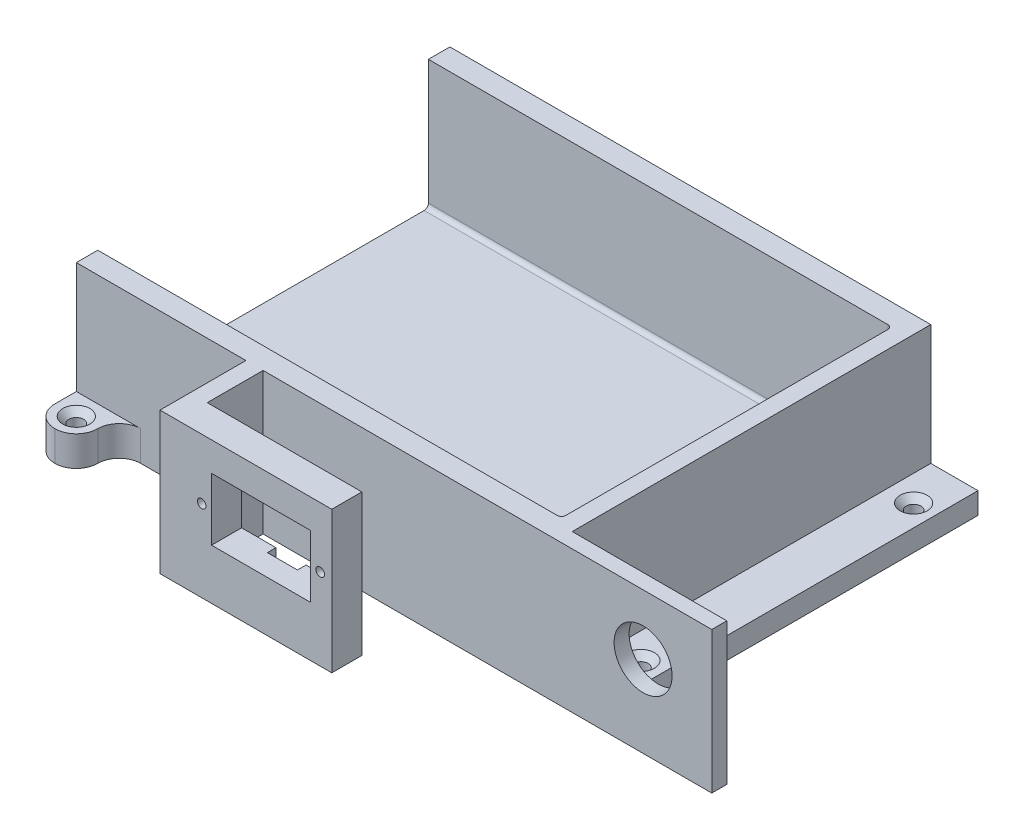
from build123d import *

# Parameters (mm, degrees)
ESQUISSE1_W                                    = 138
ESQUISSE1_H                                    = 77
BOSS_EXTRU_1_DEPTH                             = 3
ESQUISSE2_W                                    = 15
ESQUISSE2_H                                    = 77
BOSS_EXTRU_2_DEPTH                             = 30
CONG_1_R                                       = 13.85
ESQUISSE3_W                                    = 138
ESQUISSE3_H                                    = 33
BOSS_EXTRU_3_DEPTH                             = 5
ENL_V_MAT_EXTRU_13_REACH                       = 168.439
ESQUISSE26_W                                   = 15
ESQUISSE26_H                                   = 33
CONG_5_R                                       = 1
ESQUISSE33_W                                   = 11
ESQUISSE33_H                                   = 83.5
ENL_V_MAT_EXTRU_15_DEPTH                       = 28
ESQUISSE34_W                                   = 3.5
ESQUISSE34_H                                   = 33
BOSS_EXTRU_8_DEPTH                             = 25
BOSS_EXTRU_11_DEPTH                            = 33
ESQUISSE35_R                                   = 1
ESQUISSE35_W                                   = 23
ESQUISSE35_H                                   = 14.5
ENL_V_MAT_EXTRU_16_DEPTH                       = 7
ESQUISSE36_W                                   = 7
ESQUISSE36_H                                   = 11.75
ENL_V_MAT_EXTRU_17_DEPTH                       = 2
ESQUISSE44_R                                   = 6
ENL_V_MAT_EXTRU_19_DEPTH                       = 3.5
D_GAGEMENT_M124_D                              = 13.5
D_GAGEMENT_M124_DEPTH                          = 3.5
D_GAGEMENT_M124_TIP                            = 4.055809178
ESQUISSE48_R                                   = 1.5
ENL_V_MAT_EXTRU_20_DEPTH                       = 5
FRAISAGE_POUR_VIS_T_TE_FRAIS_E_M32_D           = 3.4
FRAISAGE_POUR_VIS_T_TE_FRAIS_E_M32_DEPTH       = 5
FRAISAGE_POUR_VIS_T_TE_FRAIS_E_M32_CSINK_D     = 6.3
FRAISAGE_POUR_VIS_T_TE_FRAIS_E_M32_CSINK_ANGLE = 90
FRAISAGE_POUR_VIS_T_TE_FRAIS_E_M32_TIP         = 1.021463052
ESQUISSE52_W                                   = 10
ESQUISSE52_H                                   = 10
BOSS_EXTRU_12_DEPTH                            = 7
ESQUISSE53_R                                   = 1.5
ENL_V_MAT_EXTRU_21_DEPTH                       = 7
CONG_8_R                                       = 5


with BuildPart() as part:
    # Esquisse1 → Boss.-Extru.1 (new body)
    with BuildSketch(Plane(origin=(0, 0, 0), x_dir=(1, 0, 0), z_dir=(0, 1, 0))):
        with Locations((69, 38.5)):
            Rectangle(ESQUISSE1_W, ESQUISSE1_H)
    extrude(amount=BOSS_EXTRU_1_DEPTH)

    # Esquisse2 → Boss.-Extru.2 (add)
    with BuildSketch(Plane(origin=(0, 3, 0), x_dir=(1, 0, 0), z_dir=(0, 1, 0))):
        with Locations((130.5, 38.5)):
            Rectangle(ESQUISSE2_W, ESQUISSE2_H)
    extrude(amount=BOSS_EXTRU_2_DEPTH)

    # Congé1
    cong_1_edges = [part.edges().sort_by_distance(p)[0] for p in [
        (123, 3, -38.5),
    ]]
    fillet(cong_1_edges, radius=CONG_1_R)

    # Esquisse3 → Boss.-Extru.3 (add)
    with BuildSketch(Plane(origin=(0, 0, -77), x_dir=(-1, 0, 0), z_dir=(0, 0, -1))):
        with Locations((-69, 16.5)):
            Rectangle(ESQUISSE3_W, ESQUISSE3_H)
    boss_extru_3 = extrude(amount=BOSS_EXTRU_3_DEPTH)

    # Symétrie1: Boss.-Extru.3 across plane
    add(boss_extru_3.mirror(Plane.XY.offset(-38.5)))

    # Enlèv. mat.-Extru.13: up to this face of the body (flat: up to its plane)
    enl_v_mat_extru_13_end = Plane(part.part.faces().sort_by_distance((69, 16.5, -82))[0])
    # Esquisse26 → Enlèv. mat.-Extru.13 (cut, up to the picked face)
    with BuildSketch(Plane.XY.offset(5), mode=Mode.PRIVATE) as enl_v_mat_extru_13_sk1:
        with Locations((7.5, 16.5)):
            Rectangle(ESQUISSE26_W, ESQUISSE26_H)
    enl_v_mat_extru_13_tool1 = split(extrude(enl_v_mat_extru_13_sk1.sketch, amount=-ENL_V_MAT_EXTRU_13_REACH, mode=Mode.PRIVATE), bisect_by=enl_v_mat_extru_13_end, keep=Keep.BOTH, mode=Mode.PRIVATE)
    add(enl_v_mat_extru_13_tool1.solids().sort_by(Axis((7.5, 16.5, 5), (0, 0, -1)))[0], mode=Mode.SUBTRACT)

    # Congé5
    cong_5_edges = [part.edges().sort_by_distance(p)[0] for p in [
        (123, 24.925, -77),
        (123, 24.925, 0),
        (62.075, 3, -77),
        (118.943428919, 7.056571081, 0),
        (118.943428919, 7.056571081, -77),
        (62.075, 3, 0),
    ]]
    fillet(cong_5_edges, radius=CONG_5_R)

    # Esquisse33 → Enlèv. mat.-Extru.15 (cut)
    with BuildSketch(Plane(origin=(0, 33, 0), x_dir=(1, 0, 0), z_dir=(0, 1, 0))):
        with Locations((132.5, 40.25)):
            Rectangle(ESQUISSE33_W, ESQUISSE33_H)
    extrude(amount=-ENL_V_MAT_EXTRU_15_DEPTH, mode=Mode.SUBTRACT)

    # Esquisse34 → Boss.-Extru.8 (add)
    with BuildSketch(Plane(origin=(138, 0, 0), x_dir=(0, 0, -1), z_dir=(1, 0, 0))):
        with Locations((-3.25, 16.5)):
            Rectangle(ESQUISSE34_W, ESQUISSE34_H)
    extrude(amount=BOSS_EXTRU_8_DEPTH)

    # Esquisse43 → Boss.-Extru.11 (add)
    with BuildSketch(Plane.XZ):
        Polygon((54.5, 5), (58.5, 5), (58.5, 18), (94.5, 18), (94.5, 25), (54.5, 25), align=None)
    extrude(amount=-BOSS_EXTRU_11_DEPTH)

    # Esquisse35 → Enlèv. mat.-Extru.16 (cut)
    with BuildSketch(Plane.XY.offset(25)):
        with Locations((91.8, 19)):
            Circle(ESQUISSE35_R)
        with Locations((64.2, 19)):
            Circle(ESQUISSE35_R)
        with Locations((78, 19)):
            Rectangle(ESQUISSE35_W, ESQUISSE35_H)
    extrude(amount=-ENL_V_MAT_EXTRU_16_DEPTH, mode=Mode.SUBTRACT)

    # Esquisse36 → Enlèv. mat.-Extru.17 (cut)
    with BuildSketch(Plane(origin=(0, 0, 18), x_dir=(-1, 0, 0), z_dir=(0, 0, -1))):
        with Locations((-78, 5.875)):
            Rectangle(ESQUISSE36_W, ESQUISSE36_H)
    extrude(amount=-ENL_V_MAT_EXTRU_17_DEPTH, mode=Mode.SUBTRACT)

    # Esquisse44 → Enlèv. mat.-Extru.19 (cut)
    with BuildSketch(Plane.XY.offset(5)):
        with Locations((147, 19)):
            Circle(ESQUISSE44_R)
    extrude(amount=-ENL_V_MAT_EXTRU_19_DEPTH, mode=Mode.SUBTRACT)

    # Dégagement M124
    with Locations(Plane.XY.offset(5)):
        with Locations((147, 19)):
            Hole(D_GAGEMENT_M124_D / 2, depth=D_GAGEMENT_M124_DEPTH)
            with Locations((0, 0, -(D_GAGEMENT_M124_DEPTH + D_GAGEMENT_M124_TIP / 2))):  # 118° drill point
                Cone(0, D_GAGEMENT_M124_D / 2, D_GAGEMENT_M124_TIP, mode=Mode.SUBTRACT)

    # Esquisse48 → Enlèv. mat.-Extru.20 (cut)
    with BuildSketch(Plane(origin=(0, 5, 0), x_dir=(1, 0, 0), z_dir=(0, 1, 0))):
        with Locations(Location((133, 8.5, 0), (0, 0, 270))):
            Circle(ESQUISSE48_R)
        with Locations(Location((133, 72, 0), (0, 0, 270))):
            Circle(ESQUISSE48_R)
    extrude(amount=-ENL_V_MAT_EXTRU_20_DEPTH, mode=Mode.SUBTRACT)

    # Fraisage pour vis à tête fraisée M32
    with Locations(Plane(origin=(0, 5, 0), x_dir=(1, 0, 0), z_dir=(0, 1, 0))):
        with Locations((133, 72), (133, 8.5)):
            CounterSinkHole(FRAISAGE_POUR_VIS_T_TE_FRAIS_E_M32_D / 2, FRAISAGE_POUR_VIS_T_TE_FRAIS_E_M32_CSINK_D / 2, depth=FRAISAGE_POUR_VIS_T_TE_FRAIS_E_M32_DEPTH, counter_sink_angle=FRAISAGE_POUR_VIS_T_TE_FRAIS_E_M32_CSINK_ANGLE)
            with Locations((0, 0, -(FRAISAGE_POUR_VIS_T_TE_FRAIS_E_M32_DEPTH + FRAISAGE_POUR_VIS_T_TE_FRAIS_E_M32_TIP / 2))):  # 118° drill point
                Cone(0, FRAISAGE_POUR_VIS_T_TE_FRAIS_E_M32_D / 2, FRAISAGE_POUR_VIS_T_TE_FRAIS_E_M32_TIP, mode=Mode.SUBTRACT)

    # Esquisse52 → Boss.-Extru.12 (add)
    with BuildSketch(Plane.XZ):
        with Locations((20, 10)):
            Rectangle(ESQUISSE52_W, ESQUISSE52_H)
    boss_extru_12 = extrude(amount=-BOSS_EXTRU_12_DEPTH)

    # Esquisse53 → Enlèv. mat.-Extru.21 (cut)
    with BuildSketch(Plane(origin=(0, 7, 0), x_dir=(1, 0, 0), z_dir=(0, 1, 0))):
        with Locations(Location((20, -10, 0), (0, 0, 270))):
            Circle(ESQUISSE53_R)
    enl_v_mat_extru_21 = extrude(amount=-ENL_V_MAT_EXTRU_21_DEPTH, mode=Mode.SUBTRACT)

    # Esquisse55 → Fraisage pour vis à tête fraisée M33 (revolve, cut)
    with BuildSketch(Plane(origin=(20, 7, 10), x_dir=(0, 0, 1), z_dir=(1, 0, 0))):
        Polygon((0, 0), (0, 8.021463052), (1.7, 7), (1.7, 1.45), (3.15, 0), align=None)
    fraisage_pour_vis_t_te_frais_e_m33 = revolve(axis=Axis((20, 13.35, 10), (0, -1, 0)), mode=Mode.SUBTRACT)

    # Symétrie2: Boss.-Extru.12, Enlèv. mat.-Extru.21, Fraisage pour vis à tête fraisée M33 across plane
    add(boss_extru_12.mirror(Plane.XY.offset(-38.5)))
    add(enl_v_mat_extru_21.mirror(Plane.XY.offset(-38.5)), mode=Mode.SUBTRACT)
    add(fraisage_pour_vis_t_te_frais_e_m33.mirror(Plane.XY.offset(-38.5)), mode=Mode.SUBTRACT)

    # Congé8
    cong_8_edges = [part.edges().sort_by_distance(p)[0] for p in [
        (25, 3.5, 5),
        (25, 3.5, 15),
        (15, 3.5, 15),
        (15, 3.5, -92),
        (25, 3.5, -92),
        (25, 3.5, -82),
    ]]
    fillet(cong_8_edges, radius=CONG_8_R - 0.0001)  # a hair under: the kernel refuses the full size


solid = part.part
